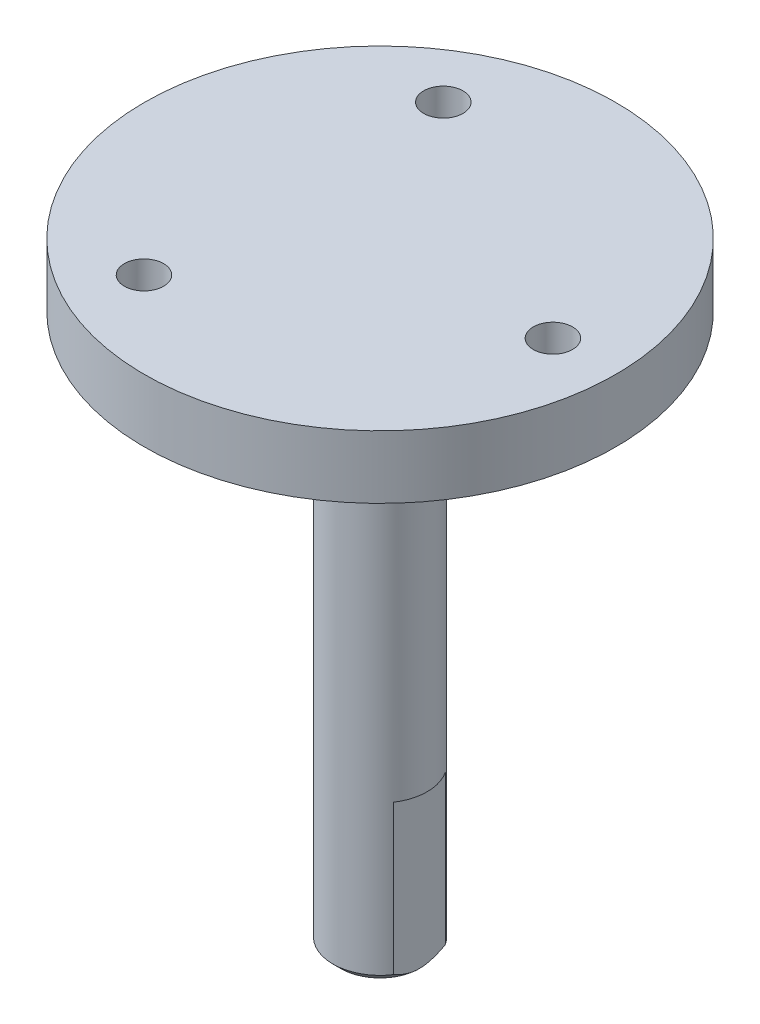
from build123d import *

# Parameters (mm, degrees)
CROQUIS1_W                                 = 3
CROQUIS1_H                                 = 39
CORTAR_EXTRUIR1_DEPTH                      = 10
CROQUIS4_R                                 = 15
SALIENTE_EXTRUIR1_DEPTH                    = 4
PERFORADOR_PARA_ROSCAR_PARA_MACHO_DE_ROS_D = 2.5
CHAFL_N1_SIZE                              = 0.5


with BuildPart() as part:
    # Croquis1 → Revolución1 (revolve)
    with BuildSketch(Plane.XY):
        with Locations((1.5, -19.5)):
            Rectangle(CROQUIS1_W, CROQUIS1_H)
    revolve(axis=Axis((0, -39, 0), (0, 1, 0)))

    # Croquis2 → Cortar-Extruir1 (cut)
    with BuildSketch(Plane.XZ.offset(39)):
        with BuildLine():
            Line((2.5, 1.658312395), (2.5, -1.658312395))
            ThreePointArc((2.5, -1.658312395), (3, 0), (2.5, 1.658312395))
        make_face()
    extrude(amount=-CORTAR_EXTRUIR1_DEPTH, mode=Mode.SUBTRACT)

    # Croquis4 → Saliente-Extruir1 (add)
    with BuildSketch(Plane(origin=(0, 0, 0), x_dir=(1, 0, 0), z_dir=(0, 1, 0))):
        with Locations(Location((0, 0, 0), (0, 0, 180))):
            Circle(CROQUIS4_R)
    extrude(amount=-SALIENTE_EXTRUIR1_DEPTH)

    # Perforador para roscar para macho de roscar para M3x0.51 (through all)
    with Locations(Plane(origin=(0, 0, 0), x_dir=(1, 0, 0), z_dir=(0, 1, 0))):
        with Locations((11, 0), (-5.5, -9.526279442), (-5.5, 9.526279442)):
            Hole(PERFORADOR_PARA_ROSCAR_PARA_MACHO_DE_ROS_D / 2)

    # Chaflán1
    chafl_n1_edges = [part.edges().sort_by_distance(p)[0] for p in [
        (-3, -39, 0),
    ]]
    chamfer(chafl_n1_edges, length=CHAFL_N1_SIZE - 0.0001)  # a hair under: the kernel refuses the full size


solid = part.part
